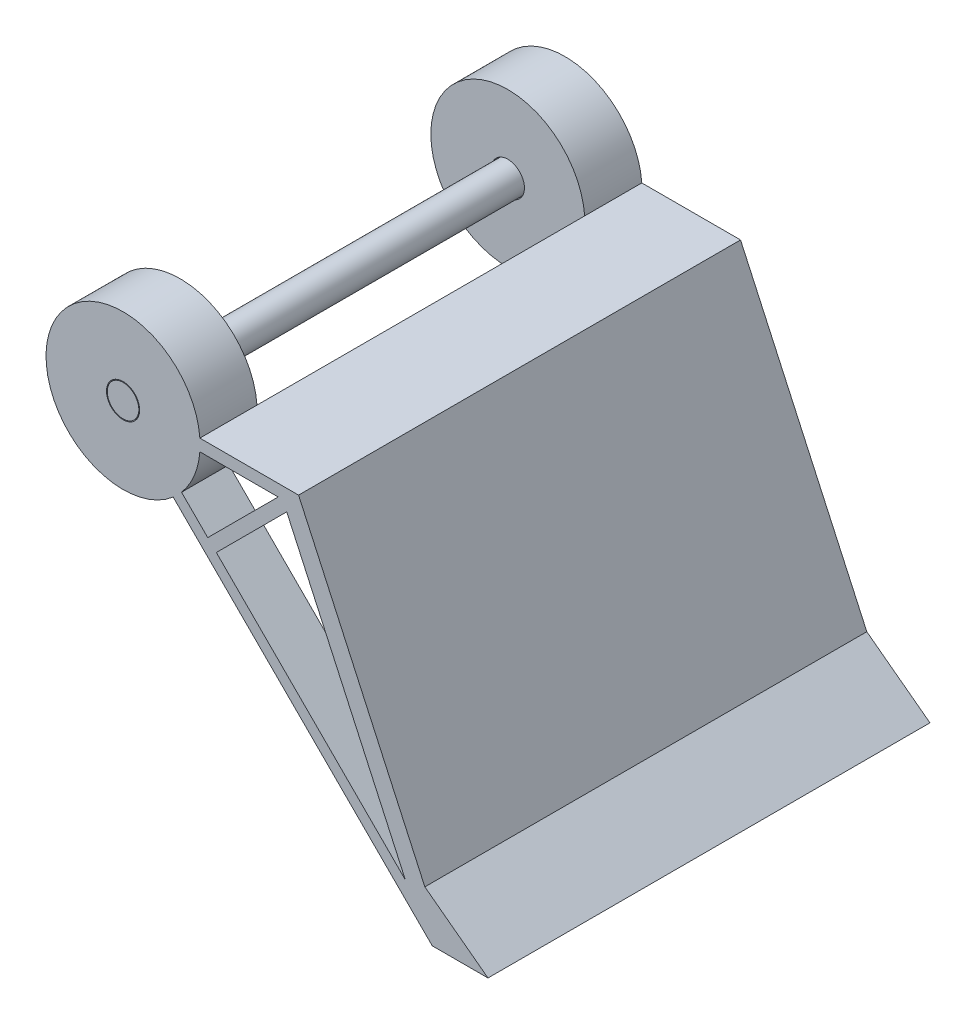
from build123d import *

# Parameters (mm, degrees)
SKETCH1_R           = 13.335
BOSS_EXTRUDE1_DEPTH = 355.6
SKETCH4_R           = 61.976
SKETCH4_R_2         = 13.335
CUT_EXTRUDE1_DEPTH  = 131.826
SKETCH5_R           = 12.7
BOSS_EXTRUDE3_DEPTH = 177.8
CUT_EXTRUDE2_START  = -139.7
CUT_EXTRUDE2_DEPTH  = 279.4


# Read off the part's stored shape, not the designer's step: Cut-Extrude2
with BuildPart() as part:
    # Sketch1 → Boss-Extrude1 (new body)
    with BuildSketch(Plane.XY):
        with BuildLine():
            Line((61.792743666, 4.7625), (141.224, 4.7625))
            Line((141.224, 4.7625), (242.824, -217.424))
            Line((242.824, -217.424), (293.624, -255.524))
            Line((293.624, -255.524), (248.788807909, -255.524))
            Line((248.788807909, -255.524), (40.326472029, -47.06166412))
            ThreePointArc((40.326472029, -47.06166412), (-57.258357907, 23.717188404), (61.792743666, 4.7625))
        make_face()
        Circle(SKETCH1_R, mode=Mode.SUBTRACT)
        Polygon((227.154568259, -220.419376168), (131.699, -11.669980332), (75.052086211, -68.316894121), align=None, mode=Mode.SUBTRACT)
        with BuildLine():
            Line((124.791519668, -4.7625), (68.144605879, -61.409413789))
            Line((68.144605879, -61.409413789), (47.06166412, -40.326472029))
            ThreePointArc((47.06166412, -40.326472029), (57.258357907, -23.717188404), (61.792743666, -4.7625))
            Line((61.792743666, -4.7625), (124.791519668, -4.7625))
        make_face(mode=Mode.SUBTRACT)
    extrude(amount=BOSS_EXTRUDE1_DEPTH)

    # Sketch4 → Cut-Extrude1 (cut, symmetric)
    with BuildSketch(Plane(origin=(0, 0, 177.8), x_dir=(-1, 0, 0), z_dir=(0, 0, -1))):
        Circle(SKETCH4_R)
        Circle(SKETCH4_R_2, mode=Mode.SUBTRACT)
    extrude(amount=CUT_EXTRUDE1_DEPTH, both=True, mode=Mode.SUBTRACT)

    # Cut-Extrude2 outline → Cut-Extrude2 (cut)
    with BuildSketch(Plane(origin=(0, 0, 177.8), x_dir=(-1, 0, 0), z_dir=(0, 0, -1)).offset(CUT_EXTRUDE2_START)):
        with BuildLine():
            Line((-124.791519668, -4.7625), (-134.122217455, -4.7625))
            Line((-134.122217455, -4.7625), (-248.788807909, -255.524))
            Line((-248.788807909, -255.524), (-40.326472029, -47.06166412))
            ThreePointArc((-40.326472029, -47.06166412), (-43.823649871, -43.823649871), (-47.06166412, -40.326472029))
            Line((-47.06166412, -40.326472029), (-68.144605879, -61.409413789))
            Line((-68.144605879, -61.409413789), (-124.791519668, -4.7625))
        make_face()
        Polygon((-131.699, -11.669980332), (-75.052086211, -68.316894121), (-227.154568259, -220.419376168), align=None, mode=Mode.SUBTRACT)
    extrude(amount=CUT_EXTRUDE2_DEPTH, mode=Mode.SUBTRACT)


with BuildPart() as body_2:
    # Sketch5 → Boss-Extrude3 (new, symmetric)
    with BuildSketch(Plane(origin=(0, 0, 177.8), x_dir=(-1, 0, 0), z_dir=(0, 0, -1))):
        Circle(SKETCH5_R)
    extrude(amount=BOSS_EXTRUDE3_DEPTH, both=True)


solid = Compound([part.part, body_2.part])
